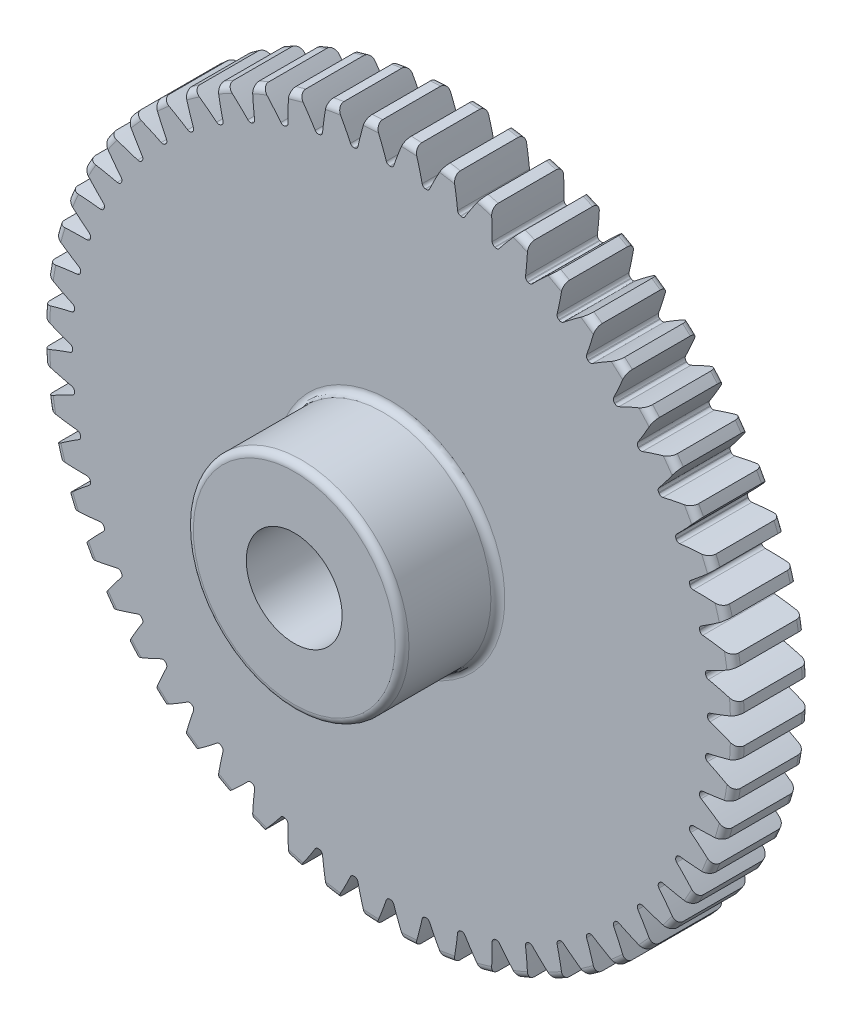
from build123d import *

# Parameters (mm, degrees)
FILLET2_R          = 0.58
CUT_EXTRUDE2_DEPTH = 42.785164901
CIRPATTERN1_COUNT  = 56


with BuildPart() as part:
    # Sketch4 → Revolve1 (revolve)
    with BuildSketch(Plane(origin=(0, 0, 0), x_dir=(0, 0, -1), z_dir=(1, 0, 0))):
        Polygon((-14, 4), (-14, 9), (-6, 9), (-6, 29), (0, 29), (0, 4), align=None)
    revolve(axis=Axis((0, 0, 6), (0, 0, 1)))

    # Fillet2
    fillet2_edges = [part.edges().sort_by_distance(p)[0] for p in [
        (0, -9, 14),
        (0, -9, 6),
        (0, -29, 6),
        (0, -29, 0),
    ]]
    fillet(fillet2_edges, radius=FILLET2_R)

    # Sketch7 → Cut-Extrude2 (cut, through all)
    with BuildSketch(Plane.XY.offset(6)):
        with BuildLine():
            ThreePointArc((-0.027795878, 26.499985422), (0, 26.5), (0.027795878, 26.499985422))
            ThreePointArc((0.027795878, 26.499985422), (0.202624802, 26.555962249), (0.312120154, 26.703303099))
            ThreePointArc((0.312120154, 26.703303099), (0.730254771, 27.848923434), (1.197878518, 28.97524956))
            ThreePointArc((1.197878518, 28.97524956), (0, 29), (-1.197878518, 28.97524956))
            ThreePointArc((-1.197878518, 28.97524956), (-0.730254771, 27.848923434), (-0.312120154, 26.703303099))
            ThreePointArc((-0.312120154, 26.703303099), (-0.202624802, 26.555962249), (-0.027795878, 26.499985422))
        make_face()
    cut_extrude2 = extrude(amount=-CUT_EXTRUDE2_DEPTH, mode=Mode.SUBTRACT)

    # CirPattern1: Cut-Extrude2 ×56 about axis
    cirpattern1_axis = Axis((0, 0, 14), (0, 0, -1))
    for i in range(1, CIRPATTERN1_COUNT):
        add(cut_extrude2.rotate(cirpattern1_axis, i * 360 / CIRPATTERN1_COUNT), mode=Mode.SUBTRACT)


solid = part.part
